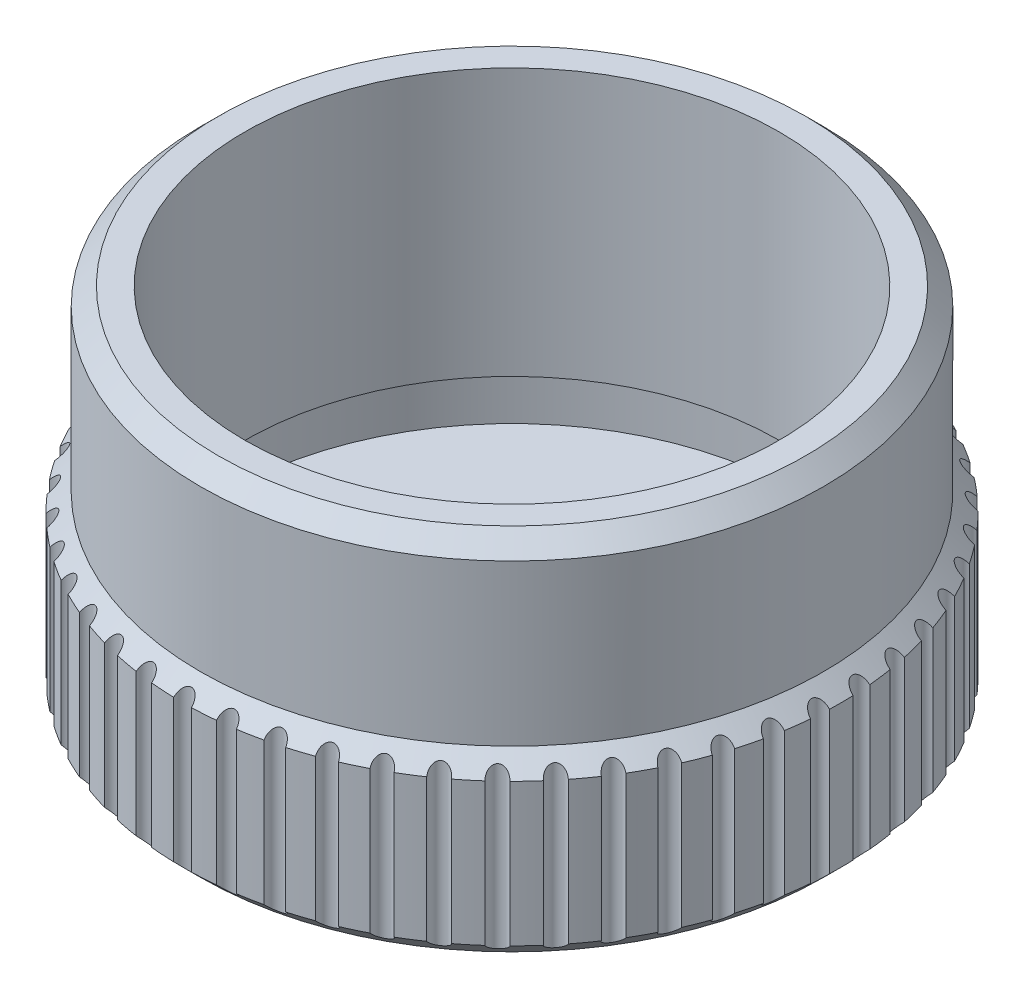
from build123d import *

# Parameters (mm, degrees)
SKETCH_1_R               = 18.5
EXTRUDE_1_DEPTH          = 10
SKETCH_3_R               = 17.5
EXTRUDE_2_DEPTH          = 10
CHAMFER_1_SIZE           = 1
CUT_EXTRUDE_1_DEPTH      = 33.9317476
PATTERN_CIRCULAR_1_COUNT = 50
CHAMFER_2_SIZE           = 1
SKETCH_8_R               = 15
CUT_EXTRUDE_2_DEPTH      = 18
SKETCH_9_R               = 16
CUT_EXTRUDE_3_DEPTH      = 3


with BuildPart() as part:
    # 草图1 → 凸台-拉伸1 (new body)
    with BuildSketch(Plane(origin=(0, 0, 0), x_dir=(1, 0, 0), z_dir=(0, 1, 0))):
        with Locations(Location((0, 0, 0), (0, 0, 270))):
            Circle(SKETCH_1_R)
    extrude(amount=EXTRUDE_1_DEPTH)

    # 草图3 → 凸台-拉伸2 (add)
    with BuildSketch(Plane(origin=(0, 10, 0), x_dir=(1, 0, 0), z_dir=(0, 1, 0))):
        with Locations(Location((0, 0, 0), (0, 0, 270))):
            Circle(SKETCH_3_R)
    extrude(amount=EXTRUDE_2_DEPTH)

    # 倒角1
    chamfer_1_edges = [part.edges().sort_by_distance(p)[0] for p in [
        (0, 0, -18.5),
        (0, 10, -18.5),
    ]]
    chamfer(chamfer_1_edges, length=CHAMFER_1_SIZE - 0.0001)  # a hair under: the kernel refuses the full size

    # 草图4 → 切除-拉伸1 (cut, through all)
    with BuildSketch(Plane.XZ):
        with BuildLine():
            ThreePointArc((0.499954344, 18.493243243), (0, 18.5), (-0.499954344, 18.493243243))
            ThreePointArc((-0.499954344, 18.493243243), (0, 18), (0.499954344, 18.493243243))
        make_face()
    cut_extrude_1 = extrude(amount=-CUT_EXTRUDE_1_DEPTH, mode=Mode.SUBTRACT)

    # 阵列(圆周)1: 切除-拉伸1 ×50 about axis
    pattern_circular_1_axis = Axis((0, 0, 0), (0, 1, 0))
    for i in range(1, PATTERN_CIRCULAR_1_COUNT):
        add(cut_extrude_1.rotate(pattern_circular_1_axis, i * 360 / PATTERN_CIRCULAR_1_COUNT), mode=Mode.SUBTRACT)

    # 倒角2
    chamfer_2_edges = [part.edges().sort_by_distance(p)[0] for p in [
        (0, 20, -17.5),
    ]]
    chamfer(chamfer_2_edges, length=CHAMFER_2_SIZE)

    # 草图8 → 切除-拉伸2 (cut)
    with BuildSketch(Plane(origin=(0, 20, 0), x_dir=(1, 0, 0), z_dir=(0, 1, 0))):
        with Locations(Location((0, 0, 0), (0, 0, 270))):
            Circle(SKETCH_8_R)
    extrude(amount=-CUT_EXTRUDE_2_DEPTH, mode=Mode.SUBTRACT)

    # 草图9 → 切除-拉伸3 (cut)
    with BuildSketch(Plane(origin=(0, 2, 0), x_dir=(1, 0, 0), z_dir=(0, 1, 0))):
        with Locations(Location((0, 0, 0), (0, 0, 270))):
            Circle(SKETCH_9_R)
    extrude(amount=CUT_EXTRUDE_3_DEPTH, mode=Mode.SUBTRACT)


solid = part.part
